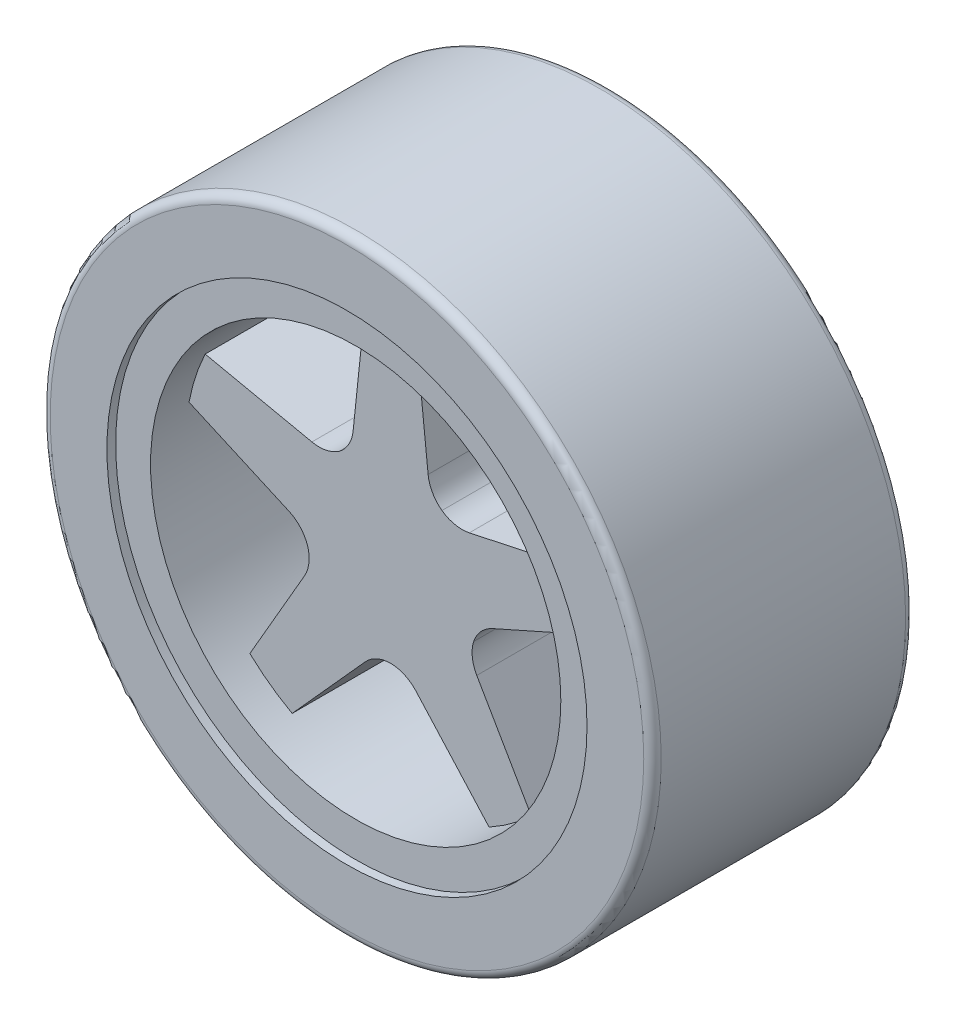
from build123d import *

# Parameters (mm, degrees)
SKETCH2_R           = 35
SKETCH2_R_2         = 27.5
BOSS_EXTRUDE2_DEPTH = 15
FILLET2_R           = 1
SKETCH4_R           = 27.5
SKETCH4_R_2         = 23.5
BOSS_EXTRUDE4_DEPTH = 14
BOSS_EXTRUDE5_DEPTH = 10
CIRPATTERN1_COUNT   = 5
FILLET3_R           = 4


with BuildPart() as part:
    # Sketch2 → Boss-Extrude2 (new, symmetric)
    with BuildSketch(Plane.XY):
        Circle(SKETCH2_R)
        Circle(SKETCH2_R_2, mode=Mode.SUBTRACT)
    extrude(amount=BOSS_EXTRUDE2_DEPTH, both=True)

    # Fillet2
    fillet2_edges = [part.edges().sort_by_distance(p)[0] for p in [
        (-35, 0, -15),
        (-35, 0, 15),
    ]]
    fillet(fillet2_edges, radius=FILLET2_R)

    # Sketch4 → Boss-Extrude4 (add, symmetric)
    with BuildSketch(Plane.XY):
        Circle(SKETCH4_R)
        Circle(SKETCH4_R_2, mode=Mode.SUBTRACT)
    extrude(amount=BOSS_EXTRUDE4_DEPTH, both=True)

    # Sketch5 → Boss-Extrude5 (add, symmetric)
    with BuildSketch(Plane.XY):
        with BuildLine():
            Line((-2.9938824, 23.308510638), (-4.5, 8.93028555))
            ThreePointArc((-4.5, 8.93028555), (0, -10), (4.5, 8.93028555))
            Line((4.5, 8.93028555), (2.9938824, 23.308510638))
            ThreePointArc((2.9938824, 23.308510638), (0, 23.5), (-2.9938824, 23.308510638))
        make_face()
    boss_extrude5 = extrude(amount=BOSS_EXTRUDE5_DEPTH, both=True)

    # CirPattern1: Boss-Extrude5 ×5 about axis
    cirpattern1_axis = Axis((0, 0, 0), (0, 0, 1))
    for i in range(1, CIRPATTERN1_COUNT):
        add(boss_extrude5.rotate(cirpattern1_axis, i * 360 / CIRPATTERN1_COUNT))

    # Fillet3
    # the kernel refuses this fillet: 4 mm, written as the material it adds along each edge
    with BuildSketch(Plane(origin=(-4.5, 8.93028555, 10), x_dir=(0.10417989743620854, 0.9945584693572224, 0), z_dir=(0, 0, -1)), Plane(origin=(-9.883782739, -1.520144324, 10), x_dir=(-0.9136879543386928, 0.40641643925458404, 0), z_dir=(0, 0, -1)), Plane(origin=(-1.60851367, -9.86978641, 10), x_dir=(-0.6688701083288824, -0.7433792963111827, 0), z_dir=(0, 0, -1)), Plane(origin=(8.88966662, -4.579719139, 10), x_dir=(0.5003034933326179, -0.8658501109078748, 0), z_dir=(0, 0, -1)), Plane(origin=(7.10262979, 7.039364323, 10), x_dir=(0.9780746718987476, 0.20825449860724982, 0), z_dir=(0, 0, -1))) as fillet3_piece_1:
        with BuildLine():
            CenterArc((1.956767483, -4), FILLET3_R, 90, 47.790159625)
            ThreePointArc((-1.005989395, -1.312608759), (-0.475813738, -0.677135992), (0, 0))
            Line((0, 0), (1.956767483, 0))
        make_face()
    extrude(amount=20)
    with BuildSketch(Plane(origin=(-7.10262979, 7.039364323, 10), x_dir=(-0.9780746718987477, 0.20825449860724976, 0), z_dir=(0, 0, -1)), Plane(origin=(-8.88966662, -4.579719139, 10), x_dir=(-0.5003034933326195, -0.8658501109078739, 0), z_dir=(0, 0, -1)), Plane(origin=(1.60851367, -9.86978641, 10), x_dir=(0.6688701083288834, -0.7433792963111817, 0), z_dir=(0, 0, -1)), Plane(origin=(9.883782739, -1.520144324, 10), x_dir=(0.9136879543386924, 0.4064164392545845, 0), z_dir=(0, 0, -1)), Plane(origin=(4.5, 8.93028555, 10), x_dir=(-0.10417989743620937, 0.9945584693572224, 0), z_dir=(0, 0, -1))) as fillet3_piece_2:
        with BuildLine():
            CenterArc((1.956767483, 4), FILLET3_R, 222.209840375, 47.790159625)
            ThreePointArc((-1.005989395, 1.312608759), (-0.475813738, 0.677135992), (0, 0))
            Line((0, 0), (1.956767483, 0))
        make_face()
    extrude(amount=20)


solid = part.part
